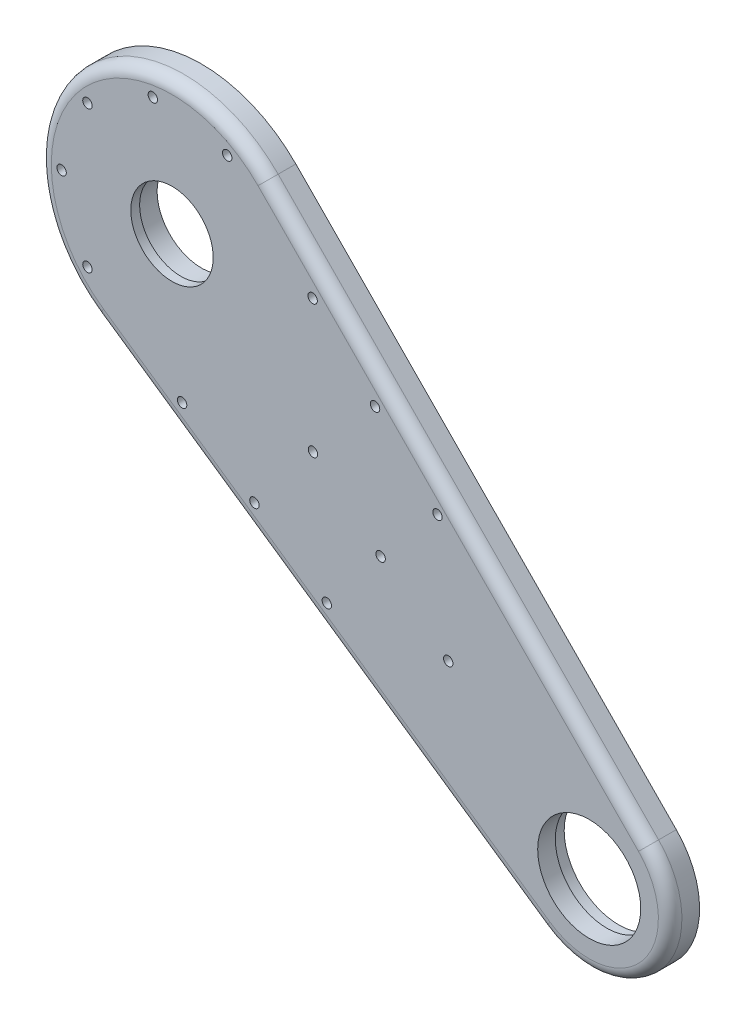
from build123d import *

# Parameters (mm, degrees)
SKETCH1_R           = 17.5
SKETCH1_R_2         = 1.6
BOSS_EXTRUDE1_DEPTH = 10
SKETCH2_R           = 18.5
CUT_EXTRUDE1_DEPTH  = 4
SKETCH3_R           = 1.6
CUT_EXTRUDE2_DEPTH  = 224.991888552
SKETCH4_R           = 14
CUT_EXTRUDE3_DEPTH  = 224.991888552
SKETCH4_3_R         = 15.0625
SKETCH4_3_R_2       = 14
CUT_EXTRUDE4_DEPTH  = 7
FILLET1_R           = 4


with BuildPart() as part:
    # Sketch1 → Boss-Extrude1 (new body)
    with BuildSketch(Plane.XY.offset(37)):
        with BuildLine():
            Line((-25.534872354, -37.053613776), (126.113577761, -141.559582877))
            ThreePointArc((126.113577761, -141.559582877), (162.784444163, -136.592367058), (161.308367688, -99.616065541))
            Line((161.308367688, -99.616065541), (32.056602073, 31.581232775))
            ThreePointArc((32.056602073, 31.581232775), (-34.47199994, 28.925442436), (-25.534872354, -37.053613776))
        make_face()
        with Locations((141.718221977, -118.915707792)):
            Circle(SKETCH1_R, mode=Mode.SUBTRACT)
        with Locations((70.859110989, -59.457853896)):
            Circle(SKETCH1_R_2, mode=Mode.SUBTRACT)
        with Locations((93.840444282, -78.741482187)):
            Circle(SKETCH1_R_2, mode=Mode.SUBTRACT)
        with Locations((47.877777695, -40.174225605)):
            Circle(SKETCH1_R_2, mode=Mode.SUBTRACT)
        with Locations((47.767990244, 4.946625931)):
            Circle(SKETCH1_R_2, mode=Mode.SUBTRACT)
        with Locations((3.423348889, -47.901259716)):
            Circle(SKETCH1_R_2, mode=Mode.SUBTRACT)
        with Locations((68.973861607, -16.273907044)):
            Circle(SKETCH1_R_2, mode=Mode.SUBTRACT)
        with Locations((90.17973297, -37.494440018)):
            Circle(SKETCH1_R_2, mode=Mode.SUBTRACT)
        with Locations((28.003855203, -65.100059364)):
            Circle(SKETCH1_R_2, mode=Mode.SUBTRACT)
        with Locations((52.584361518, -82.298859012)):
            Circle(SKETCH1_R_2, mode=Mode.SUBTRACT)
    extrude(amount=BOSS_EXTRUDE1_DEPTH)

    # Sketch2 → Cut-Extrude1 (cut)
    with BuildSketch(Plane(origin=(0, 0, 37), x_dir=(-1, 0, 0), z_dir=(0, 0, -1))):
        with Locations((-141.718221977, -118.915707792)):
            Circle(SKETCH2_R)
    extrude(amount=-CUT_EXTRUDE1_DEPTH, mode=Mode.SUBTRACT)

    # Sketch3 → Cut-Extrude2 (cut, through all)
    with BuildSketch(Plane(origin=(0, 0, 37), x_dir=(-1, 0, 0), z_dir=(0, 0, -1))):
        with Locations((-18.75, 32.475952642)):
            Circle(SKETCH3_R)
        with Locations((6.511806663, 36.930290738)):
            Circle(SKETCH3_R)
        with Locations((28.726666617, 24.104535363)):
            Circle(SKETCH3_R)
        with Locations((37.5, 0)):
            Circle(SKETCH3_R)
        with Locations((28.726666617, -24.104535363)):
            Circle(SKETCH3_R)
    extrude(amount=-CUT_EXTRUDE2_DEPTH, mode=Mode.SUBTRACT)

    # Sketch4 → Cut-Extrude3 (cut, through all)
    with BuildSketch(Plane(origin=(0, 0, 37), x_dir=(-1, 0, 0), z_dir=(0, 0, -1))):
        Circle(SKETCH4_R)
    extrude(amount=-CUT_EXTRUDE3_DEPTH, mode=Mode.SUBTRACT)

    # Sketch4<3> → Cut-Extrude4 (cut)
    with BuildSketch(Plane(origin=(0, 0, 37), x_dir=(-1, 0, 0), z_dir=(0, 0, -1))):
        Circle(SKETCH4_3_R)
        Circle(SKETCH4_3_R_2, mode=Mode.SUBTRACT)
    extrude(amount=-CUT_EXTRUDE4_DEPTH, mode=Mode.SUBTRACT)

    # Fillet1
    fillet1_edges = [part.edges().sort_by_distance(p)[0] for p in [
        (162.784444163, -136.592367058, 47),
        (50.289352703, -89.306598327, 47),
        (-34.47199994, 28.925442436, 47),
        (96.68248488, -34.017416383, 47),
    ]]
    fillet(fillet1_edges, radius=FILLET1_R)


solid = part.part
